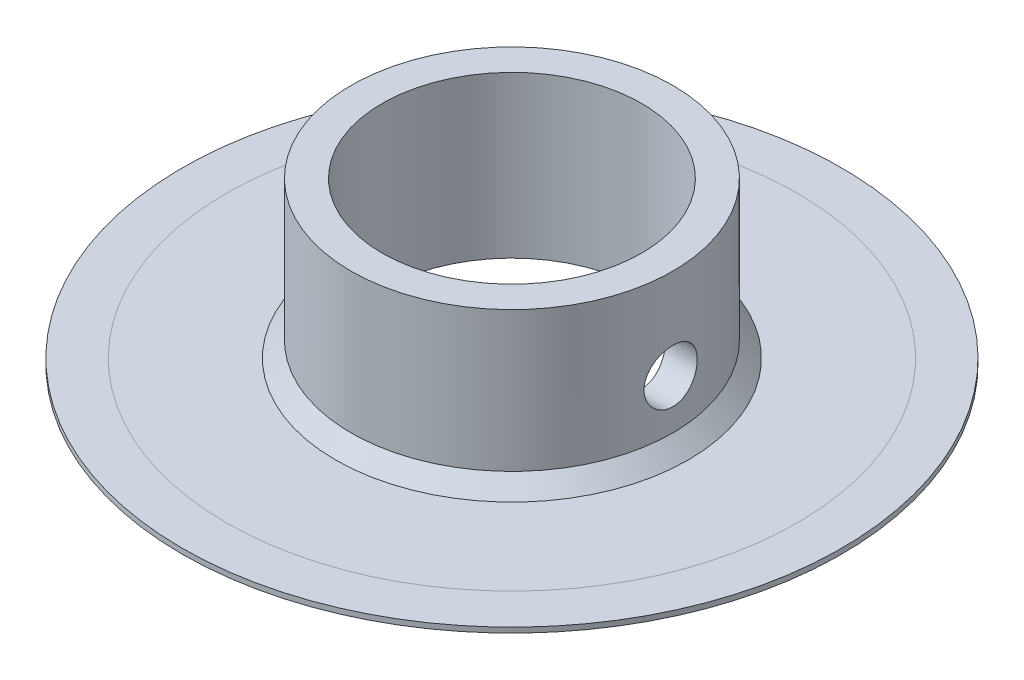
from build123d import *

# Parameters (mm, degrees)
SKETCH1_R               = 12.7
BOSS_EXTRUDE1_DEPTH     = 0.2
SKETCH2_R               = 7
BOSS_EXTRUDE2_DEPTH     = 0.8
SKETCH3_R               = 6.2
BOSS_EXTRUDE3_DEPTH     = 5.2
CHAMFER1_SIZE           = 1
SKETCH5_R               = 5
CUT_EXTRUDE1_DEPTH      = 20.000526308
M2_5_TAPPED_HOLE1_D     = 2.05
M2_5_TAPPED_HOLE1_DEPTH = 6.199
M2_5_TAPPED_HOLE1_TIP   = 0.615882135


with BuildPart() as part:
    # Sketch1 → Boss-Extrude1 (new body)
    with BuildSketch(Plane(origin=(0, 0, 0), x_dir=(1, 0, 0), z_dir=(0, 1, 0))):
        with Locations(Location((0, 0, 0), (0, 0, 270))):
            Circle(SKETCH1_R)
    extrude(amount=BOSS_EXTRUDE1_DEPTH)

    # Sketch2 → Boss-Extrude2 (add)
    with BuildSketch(Plane(origin=(0, 0.2, 0), x_dir=(1, 0, 0), z_dir=(0, 1, 0))):
        with Locations(Location((0, 0, 0), (0, 0, 270))):
            Circle(SKETCH2_R)
    extrude(amount=BOSS_EXTRUDE2_DEPTH)

    # Sketch3 → Boss-Extrude3 (add)
    with BuildSketch(Plane(origin=(0, 1, 0), x_dir=(1, 0, 0), z_dir=(0, 1, 0))):
        with Locations(Location((0, 0, 0), (0, 0, 270))):
            Circle(SKETCH3_R)
    extrude(amount=BOSS_EXTRUDE3_DEPTH)

    # Chamfer1
    # the kernel refuses this chamfer: 1 mm, written as the material it takes off along each edge
    with BuildSketch(Plane(origin=(0, 1, 0), x_dir=(0, 0, 1), z_dir=(-1, 0, 0))) as chamfer1_piece_1_section:
        Polygon((7, -CHAMFER1_SIZE), (7 - CHAMFER1_SIZE, 0), (7, 0), align=None)
    chamfer1_piece_1 = revolve(axis=Axis((0, 1, 0), (0, 1, 0)), mode=Mode.PRIVATE)
    chamfer1_piece_1 = split(chamfer1_piece_1, bisect_by=Plane(origin=(0, 0.2, -6.519416157), z_dir=(0, 1, 0)), keep=Keep.TOP, mode=Mode.PRIVATE)
    chamfer1_piece_1 = chamfer1_piece_1 - Plane(origin=(0, 0.519416157, 0), x_dir=(0, 0, 1), z_dir=(0, -1, 0)) * Cylinder(6.2, 28, mode=Mode.PRIVATE)
    add(chamfer1_piece_1, mode=Mode.SUBTRACT)

    # Sketch5 → Cut-Extrude1 (cut, through all)
    with BuildSketch(Plane(origin=(0, 6.2, 0), x_dir=(1, 0, 0), z_dir=(0, 1, 0))):
        with Locations(Location((0, 0, 0), (0, 0, 270))):
            Circle(SKETCH5_R)
    extrude(amount=-CUT_EXTRUDE1_DEPTH, mode=Mode.SUBTRACT)

    # M2.5 Tapped Hole1
    with Locations(Plane(origin=(6.2, 2.7, 0), x_dir=(0, 0, 1), z_dir=(1, 0, 0))):
        with Locations((0, 0)):
            Hole(M2_5_TAPPED_HOLE1_D / 2, depth=M2_5_TAPPED_HOLE1_DEPTH)
            with Locations((0, 0, -(M2_5_TAPPED_HOLE1_DEPTH + M2_5_TAPPED_HOLE1_TIP / 2))):  # 118° drill point
                Cone(0, M2_5_TAPPED_HOLE1_D / 2, M2_5_TAPPED_HOLE1_TIP, mode=Mode.SUBTRACT)


solid = part.part
